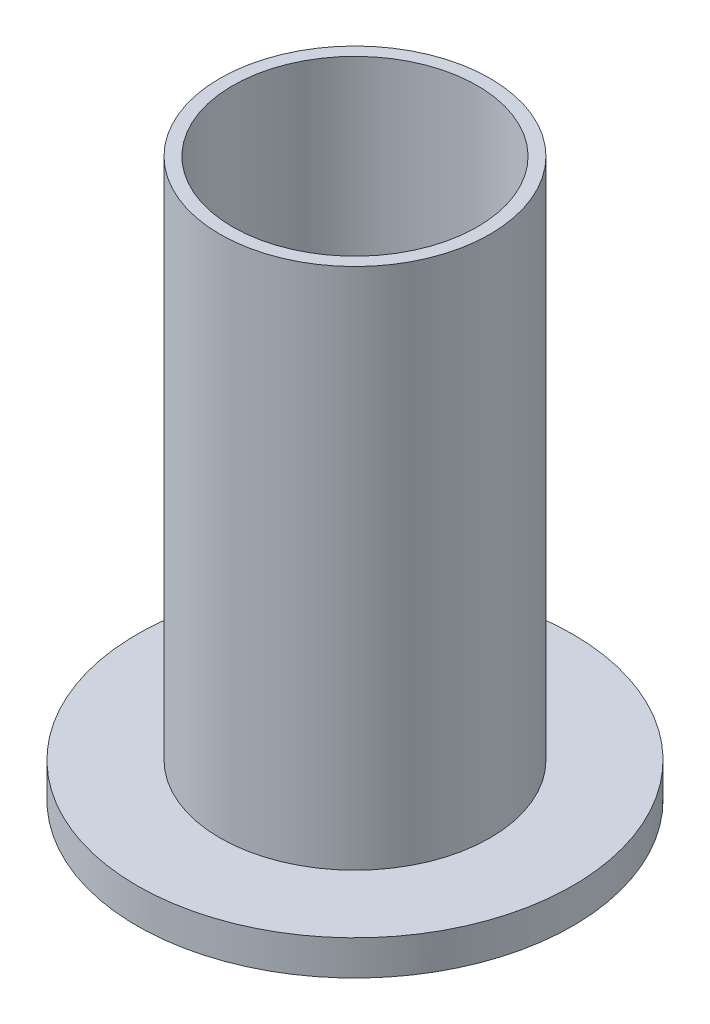
from build123d import *

# Parameters (mm, degrees)
SKETCH1_W           = 101.6
SKETCH1_H           = 101.6
BOSS_EXTRUDE1_DEPTH = 10
SKETCH2_R           = 5
CUT_EXTRUDE1_DEPTH  = 5
SKETCH3_R           = 12.5
BOSS_EXTRUDE2_DEPTH = 2
SKETCH4_R           = 7.75
BOSS_EXTRUDE3_DEPTH = 30
SKETCH6_W           = 101.6
SKETCH6_H           = 101.6
CUT_EXTRUDE2_DEPTH  = 10
SKETCH7_R           = 7.023915829
CUT_EXTRUDE3_DEPTH  = 30


with BuildPart() as part:
    # Sketch1 → Boss-Extrude1 (new body)
    with BuildSketch(Plane(origin=(0, 0, 0), x_dir=(1, 0, 0), z_dir=(0, 1, 0))):
        Rectangle(SKETCH1_W, SKETCH1_H)
    extrude(amount=BOSS_EXTRUDE1_DEPTH)

    # Sketch2 → Cut-Extrude1 (cut)
    with BuildSketch(Plane(origin=(0, 0, 0), x_dir=(-1, 0, 0), z_dir=(0, -1, 0))):
        Circle(SKETCH2_R)
    extrude(amount=-CUT_EXTRUDE1_DEPTH, mode=Mode.SUBTRACT)

    # Sketch3 → Boss-Extrude2 (add)
    with BuildSketch(Plane(origin=(0, 10, 0), x_dir=(1, 0, 0), z_dir=(0, 1, 0))):
        Circle(SKETCH3_R)
    extrude(amount=BOSS_EXTRUDE2_DEPTH)

    # Sketch4 → Boss-Extrude3 (add)
    with BuildSketch(Plane(origin=(0, 12, 0), x_dir=(1, 0, 0), z_dir=(0, 1, 0))):
        Circle(SKETCH4_R)
    extrude(amount=BOSS_EXTRUDE3_DEPTH)

    # Sketch6 → Cut-Extrude2 (cut)
    with BuildSketch(Plane(origin=(0, 10, 0), x_dir=(1, 0, 0), z_dir=(0, 1, 0))):
        Rectangle(SKETCH6_W, SKETCH6_H)
    extrude(amount=-CUT_EXTRUDE2_DEPTH, mode=Mode.SUBTRACT)

    # Sketch7 → Cut-Extrude3 (cut)
    with BuildSketch(Plane(origin=(0, 42, 0), x_dir=(1, 0, 0), z_dir=(0, 1, 0))):
        Circle(SKETCH7_R)
    extrude(amount=-CUT_EXTRUDE3_DEPTH, mode=Mode.SUBTRACT)


solid = part.part
